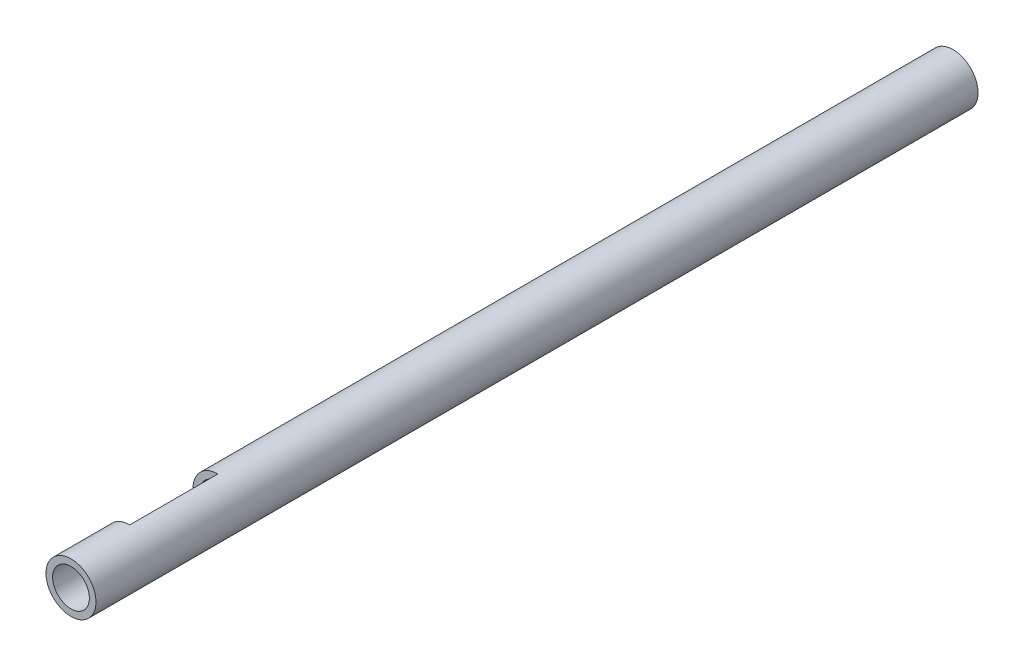
from build123d import *

# Parameters (mm, degrees)
SKETCH1_W               = 600
SKETCH1_H               = 4.5
CUT_EXTRUDE1_DEPTH      = 601.481473486
CUT_EXTRUDE1_DEPTH_BACK = 601.481473486
SKETCH2_W               = 37.714751534
SKETCH2_H               = 60


with BuildPart() as part:
    # Sketch1 → Revolve1 (revolve)
    with BuildSketch(Plane(origin=(0, 0, 0), x_dir=(0, 0, -1), z_dir=(1, 0, 0))):
        with Locations((-300, 14.75)):
            Rectangle(SKETCH1_W, SKETCH1_H)
    revolve(axis=Axis((0, 0, 0), (0, 0, 1)))

    # Sketch2 → Cut-Extrude1 (cut, two sides: drawn at the far end of the back side and taken through both)
    with BuildSketch(Plane(origin=(0, 0, 0), x_dir=(1, 0, 0), z_dir=(0, 1, 0)).offset(-CUT_EXTRUDE1_DEPTH_BACK)):
        with Locations((-18.857375767, -530)):
            Rectangle(SKETCH2_W, SKETCH2_H)
    extrude(amount=CUT_EXTRUDE1_DEPTH + CUT_EXTRUDE1_DEPTH_BACK, mode=Mode.SUBTRACT)


solid = part.part
